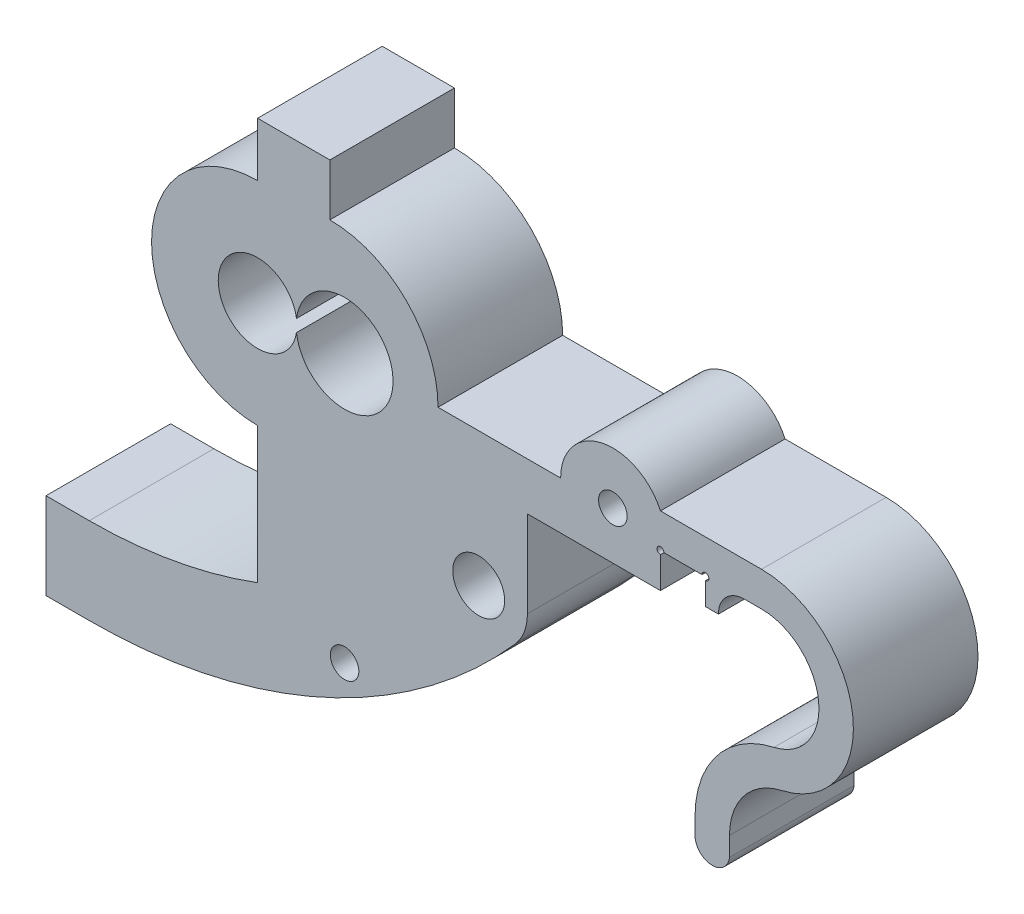
from build123d import *

# Parameters (mm, degrees)
SKETCH1_R           = 3
SKETCH1_R_2         = 1.65
BOSS_EXTRUDE1_DEPTH = 14.4
SKETCH2_R           = 4.55
CUT_EXTRUDE1_DEPTH  = 63.155932943
SKETCH3_R           = 5.6
CUT_EXTRUDE2_DEPTH  = 9.5


with BuildPart() as part:
    # Sketch1 → Boss-Extrude1 (new body)
    with BuildSketch(Plane.XY):
        with BuildLine():
            Line((-50, -26), (-45, -26))
            ThreePointArc((-45, -26), (-17.980580633, -20.169004037), (4.229338303, -3.713942879))
            ThreePointArc((4.229338303, -3.713942879), (5.267150725, -1.984388427), (5.628558802, 0))
            Line((5.628558802, 0), (5.628558802, 10))
            Line((5.628558802, 10), (21, 10))
            Line((21, 10), (21, 13.6))
            ThreePointArc((21, 13.6), (20.717157288, 14.282842712), (21.4, 14))
            Line((21.4, 14), (25.8, 14))
            ThreePointArc((25.8, 14), (26.482842712, 14.282842712), (26.2, 13.6))
            Line((26.2, 13.6), (26.2, 11))
            Line((26.2, 11), (27.7, 11))
            ThreePointArc((27.7, 11), (28.578679656, 13.121320344), (30.7, 14))
            Line((30.7, 14), (32.676918423, 14))
            ThreePointArc((32.676918423, 14), (39.276357231, 8.087589664), (34.122067826, 0.880475866))
            ThreePointArc((34.122067826, 0.880475866), (27.561980044, -3.207412113), (25, -10.5))
            Line((25, -10.5), (25, -12.711352771))
            ThreePointArc((25, -12.711352771), (26.988990508, -14.499335509), (28.977515918, -12.71083552))
            Line((28.977515918, -12.71083552), (28.977515918, -10.5))
            ThreePointArc((28.977515918, -10.5), (30.665543869, -5.695086622), (34.987830282, -3.001674086))
            ThreePointArc((34.987830282, -3.001674086), (43.229959772, 8.523089175), (32.676918423, 17.977515918))
            Line((32.676918423, 17.977515918), (21, 17.977515918))
            ThreePointArc((21, 17.977515918), (14.232977983, 21.397689406), (9.467746265, 15.5))
            Line((9.467746265, 15.5), (-4.7, 15.5))
            ThreePointArc((-4.7, 15.5), (-8.361165235, 24.338834765), (-17.2, 28))
            Line((-17.2, 28), (-17.2, 34))
            Line((-17.2, 34), (-25.55, 34))
            Line((-25.55, 34), (-25.55, 27.754338603))
            ThreePointArc((-25.55, 27.754338603), (-37.804338603, 15.5), (-25.55, 3.245661397))
            Line((-25.55, 3.245661397), (-25.55, -12.481358095))
            ThreePointArc((-25.55, -12.481358095), (-35.11714438, -15.113257701), (-45, -16))
            Line((-45, -16), (-50, -16))
            Line((-50, -16), (-50, -26))
        make_face()
        Circle(SKETCH1_R, mode=Mode.SUBTRACT)
        with Locations((-15.5, 15.5)):
            Circle(SKETCH1_R_2, mode=Mode.SUBTRACT)
        with Locations((15.5, 15.5)):
            Circle(SKETCH1_R_2, mode=Mode.SUBTRACT)
        with Locations((-15.5, -15.5)):
            Circle(SKETCH1_R_2, mode=Mode.SUBTRACT)
    extrude(amount=BOSS_EXTRUDE1_DEPTH)

    # Sketch2 → Cut-Extrude1 (cut, through all)
    with BuildSketch(Plane.XY.offset(14.4)):
        with Locations((-25.55, 15.5)):
            Circle(SKETCH2_R)
    extrude(amount=-CUT_EXTRUDE1_DEPTH, mode=Mode.SUBTRACT)

    # Sketch3 → Cut-Extrude2 (cut)
    with BuildSketch(Plane.XY.offset(14.4)):
        with Locations((-15.5, 15.5)):
            Circle(SKETCH3_R)
    extrude(amount=-CUT_EXTRUDE2_DEPTH, mode=Mode.SUBTRACT)


solid = part.part
